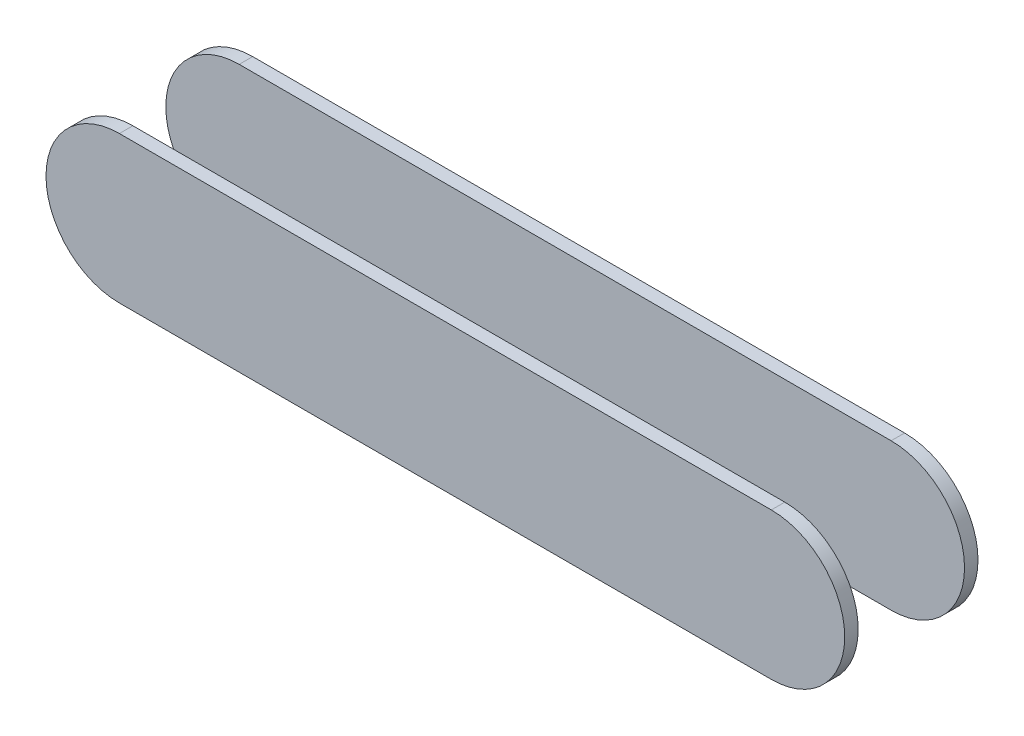
from build123d import *

# Parameters (mm, degrees)
BOSS_EXTRUDE1_DEPTH = 4.7625
BOSS_EXTRUDE2_DEPTH = 4.7625


with BuildPart() as part:
    # Sketch1 → Boss-Extrude1 (new body)
    with BuildSketch(Plane.XY):
        with BuildLine():
            Line((230.49, 25.948546581), (0, 25.948546581))
            ThreePointArc((0, 25.948546581), (-25.948546581, 0), (0, -25.948546581))
            Line((0, -25.948546581), (230.49, -25.948546581))
            ThreePointArc((230.49, -25.948546581), (256.438546581, 0), (230.49, 25.948546581))
        make_face()
    extrude(amount=BOSS_EXTRUDE1_DEPTH)


with BuildPart() as body_2:
    # Sketch2 → Boss-Extrude2 (new body)
    with BuildSketch(Plane.XY.offset(42.362499984)):
        with BuildLine():
            Line((0, 25.948546581), (230.49, 25.948546581))
            ThreePointArc((230.49, 25.948546581), (256.438546581, 0), (230.49, -25.948546581))
            Line((230.49, -25.948546581), (0, -25.948546581))
            ThreePointArc((0, -25.948546581), (-25.948546581, 0), (0, 25.948546581))
        make_face()
    extrude(amount=BOSS_EXTRUDE2_DEPTH)


solid = Compound([part.part, body_2.part])
